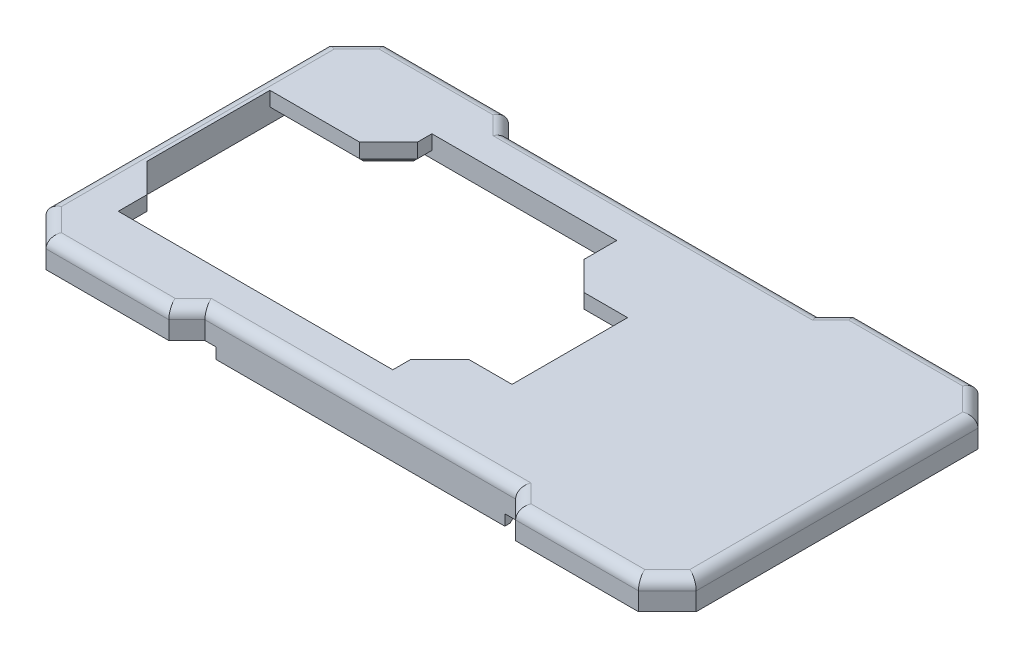
from build123d import *

# Parameters (mm, degrees)
SKETCH1_W           = 90
SKETCH1_H           = 47
BOSS_EXTRUDE1_DEPTH = 4
CUT_EXTRUDE1_START  = -4
CUT_EXTRUDE1_DEPTH  = 106.612007165
FILLET1_R           = 6.4
CUT_EXTRUDE3_START  = -4
SKETCH4_R           = 2.57
CUT_EXTRUDE3_DEPTH  = 3.2
SKETCH5_W           = 20
SKETCH5_H           = 4
CUT_EXTRUDE4_DEPTH  = 21.1
CHAMFER1_SIZE       = 4
BOSS_EXTRUDE2_DEPTH = 3
CHAMFER2_SIZE       = 4
CHAMFER3_SIZE       = 4
SKETCH7_W           = 12
SKETCH7_H           = 34
CUT_EXTRUDE5_DEPTH  = 2.5
FILLET2_R           = 1.5
CHAMFER4_SIZE       = 1
BOSS_EXTRUDE3_DEPTH = 5.5
CUT_EXTRUDE6_DEPTH  = 1.5
FILLET3_R           = 1.5
BOSS_EXTRUDE4_DEPTH = 1.5
CHAMFER6_SIZE       = 0.75


with BuildPart() as part:
    # Sketch1 → Boss-Extrude1 (new body)
    with BuildSketch(Plane(origin=(0, 0, 0), x_dir=(1, 0, 0), z_dir=(0, 1, 0))):
        with Locations((45, 23.5)):
            Rectangle(SKETCH1_W, SKETCH1_H)
    extrude(amount=BOSS_EXTRUDE1_DEPTH)

    # Sketch2 → Cut-Extrude1 (cut, through all)
    with BuildSketch(Plane(origin=(0, 4, 0), x_dir=(1, 0, 0), z_dir=(0, 1, 0)).offset(CUT_EXTRUDE1_START)):
        Polygon((2, 23.5), (2, 40.5), (54, 40.5), (54, 6.5), (2, 6.5), align=None)
    extrude(amount=CUT_EXTRUDE1_DEPTH, mode=Mode.SUBTRACT)

    # Fillet1
    fillet1_edges = [part.edges().sort_by_distance(p)[0] for p in [
        (54, 2, -40.5),
        (2, 2, -6.5),
    ]]
    fillet(fillet1_edges, radius=FILLET1_R)

    # Sketch4 → Cut-Extrude3 (cut)
    with BuildSketch(Plane(origin=(0, 4, 0), x_dir=(1, 0, 0), z_dir=(0, 1, 0)).offset(CUT_EXTRUDE3_START)):
        with Locations(Location((13, 43.75, 0), (0, 0, 90))):
            Circle(SKETCH4_R)
        with Locations(Location((13, 3.25, 0), (0, 0, 90))):
            Circle(SKETCH4_R)
        with Locations(Location((77, 3.25, 0), (0, 0, 90))):
            Circle(SKETCH4_R)
        with Locations(Location((77, 43.75, 0), (0, 0, 90))):
            Circle(SKETCH4_R)
    extrude(amount=CUT_EXTRUDE3_DEPTH, mode=Mode.SUBTRACT)

    # Sketch5 → Cut-Extrude4 (cut)
    with BuildSketch(Plane(origin=(0, 4, 0), x_dir=(1, 0, 0), z_dir=(0, 1, 0))):
        with Locations((35, 2)):
            Rectangle(SKETCH5_W, SKETCH5_H)
        with Locations((55, 2)):
            Rectangle(SKETCH5_W, SKETCH5_H)
        with Locations((35, 45)):
            Rectangle(SKETCH5_W, SKETCH5_H)
        with Locations((55, 45)):
            Rectangle(SKETCH5_W, SKETCH5_H)
    extrude(amount=-CUT_EXTRUDE4_DEPTH, mode=Mode.SUBTRACT)

    # Chamfer1
    chamfer1_edges = [part.edges().sort_by_distance(p)[0] for p in [
        (90, 2, 0),
        (90, 2, -47),
        (0, 2, -47),
        (0, 2, 0),
        (25, 2, -47),
        (65, 2, -47),
        (65, 2, 0),
        (25, 2, 0),
    ]]
    chamfer(chamfer1_edges, length=CHAMFER1_SIZE - 0.0001)  # a hair under: the kernel refuses the full size

    # Sketch6 → Boss-Extrude2 (add)
    with BuildSketch(Plane(origin=(0, 4, 0), x_dir=(1, 0, 0), z_dir=(0, 1, 0))):
        Polygon((54, 6.5), (54, 14.5), (44, 14.5), (44, 8), (6, 8), (6, 16), (2, 16), (2, 6.5), (42, 6.5), align=None)
        Polygon((47.6, 40.5), (54, 40.5), (54, 30.5), (44, 30.5), (44, 39), (18.412776199, 39), (18.412776199, 33), (2, 33), (2, 40.5), align=None)
    extrude(amount=-BOSS_EXTRUDE2_DEPTH)

    # Chamfer2
    chamfer2_edges = [part.edges().sort_by_distance(p)[0] for p in [
        (44, 2.5, -14.5),
        (44, 2.5, -30.5),
        (18.412776199, 2.5, -33),
    ]]
    chamfer(chamfer2_edges, length=CHAMFER2_SIZE)

    # Chamfer3
    chamfer3_edges = [part.edges().sort_by_distance(p)[0] for p in [
        (6, 2.5, -16),
    ]]
    chamfer(chamfer3_edges, length=CHAMFER3_SIZE - 0.0001)  # a hair under: the kernel refuses the full size

    # Sketch7 → Cut-Extrude5 (cut)
    with BuildSketch(Plane.XZ):
        Polygon((65, -22.5), (56, -22.5), (56, -40.5), (74, -40.5), (74, -22.5), align=None)
        Polygon((56, -6.5), (74, -6.5), (74, -21.5), (65, -21.5), (56, -21.5), align=None)
        with Locations((82, -23.5)):
            Rectangle(SKETCH7_W, SKETCH7_H)
    extrude(amount=-CUT_EXTRUDE5_DEPTH, mode=Mode.SUBTRACT)

    # Fillet2
    fillet2_edges = [part.edges().sort_by_distance(p)[0] for p in [
        (76, 1.25, -6.5),
        (88, 1.25, -6.5),
        (88, 1.25, -40.5),
        (76, 1.25, -40.5),
        (56, 1.25, -21.5),
        (56, 1.25, -6.5),
        (74, 1.25, -6.5),
        (74, 1.25, -21.5),
        (74, 1.25, -22.5),
        (74, 1.25, -40.5),
        (56, 1.25, -40.5),
        (56, 1.25, -22.5),
    ]]
    fillet(fillet2_edges, radius=FILLET2_R)

    # Chamfer4
    chamfer4_edges = [part.edges().sort_by_distance(p)[0] for p in [
        (6, 1, -10.00005),
        (51, 1, -14.5),
        (44, 1, -36.75),
        (8.206388099, 1, -33),
        (18.412776199, 1, -38),
        (51, 1, -30.5),
        (46, 1, -32.5),
        (16.412776199, 1, -35),
        (44, 1, -9.25),
        (46, 1, -12.5),
        (4.00005, 1, -14.00005),
    ]]
    chamfer(chamfer4_edges, length=CHAMFER4_SIZE)

    # Sketch8 → Boss-Extrude3 (add)
    with BuildSketch(Plane(origin=(0, 4, 0), x_dir=(1, 0, 0), z_dir=(0, 1, 0))):
        Polygon((65, 4), (45, 4), (45, 2.5), (66.5, 2.5), align=None)
        Polygon((45, 2.5), (45, 4), (25, 4), (23.5, 2.5), align=None)
        Polygon((66.5, 44.5), (45, 44.5), (45, 43), (65, 43), align=None)
        Polygon((45, 44.5), (23.5, 44.5), (25, 43), (45, 43), align=None)
    extrude(amount=-BOSS_EXTRUDE3_DEPTH)

    # Sketch10 → Cut-Extrude6 (cut)
    with BuildSketch(Plane(origin=(0, -1.5, 0), x_dir=(-1, 0, 0), z_dir=(0, -1, 0))):
        Polygon((-25, 4), (-25, 2.5), (-23.5, 2.5), align=None)
        Polygon((-65, 4), (-65, 2.5), (-66.5, 2.5), align=None)
        Polygon((-65, 43), (-65, 44.5), (-66.5, 44.5), align=None)
        Polygon((-25, 43), (-25, 44.5), (-23.5, 44.5), align=None)
    extrude(amount=-CUT_EXTRUDE6_DEPTH, mode=Mode.SUBTRACT)

    # Fillet3
    fillet3_edges = [part.edges().sort_by_distance(p)[0] for p in [
        (77.5, 4, 0),
        (90, 4, -23.5),
        (77.5, 4, -47),
        (12.5, 4, -47),
        (0, 4, -23.5),
        (12.5, 4, 0),
        (1.99995, 4, -1.99995),
        (1.99995, 4, -45.00005),
        (88.00005, 4, -45.00005),
        (88.00005, 4, -1.99995),
        (22.2501, 4, -1.25),
        (67.7499, 4, -45.75),
        (67.7499, 4, -1.25),
        (45, 4, -2.5),
        (22.2501, 4, -45.75),
        (45, 4, -44.5),
    ]]
    fillet(fillet3_edges, radius=FILLET3_R)

    # Sketch11 → Boss-Extrude4 (add)
    with BuildSketch(Plane.XZ):
        Polygon((0, -23.5), (0, -16.5), (1.25, -16.5), (1.25, -30.5), (0, -30.5), align=None)
    extrude(amount=BOSS_EXTRUDE4_DEPTH)

    # Chamfer6
    chamfer6_edges = [part.edges().sort_by_distance(p)[0] for p in [
        (45, -1.5, -4),
        (45, -1.5, -43),
        (1.25, -1.5, -23.5),
    ]]
    chamfer(chamfer6_edges, length=CHAMFER6_SIZE)


solid = part.part
